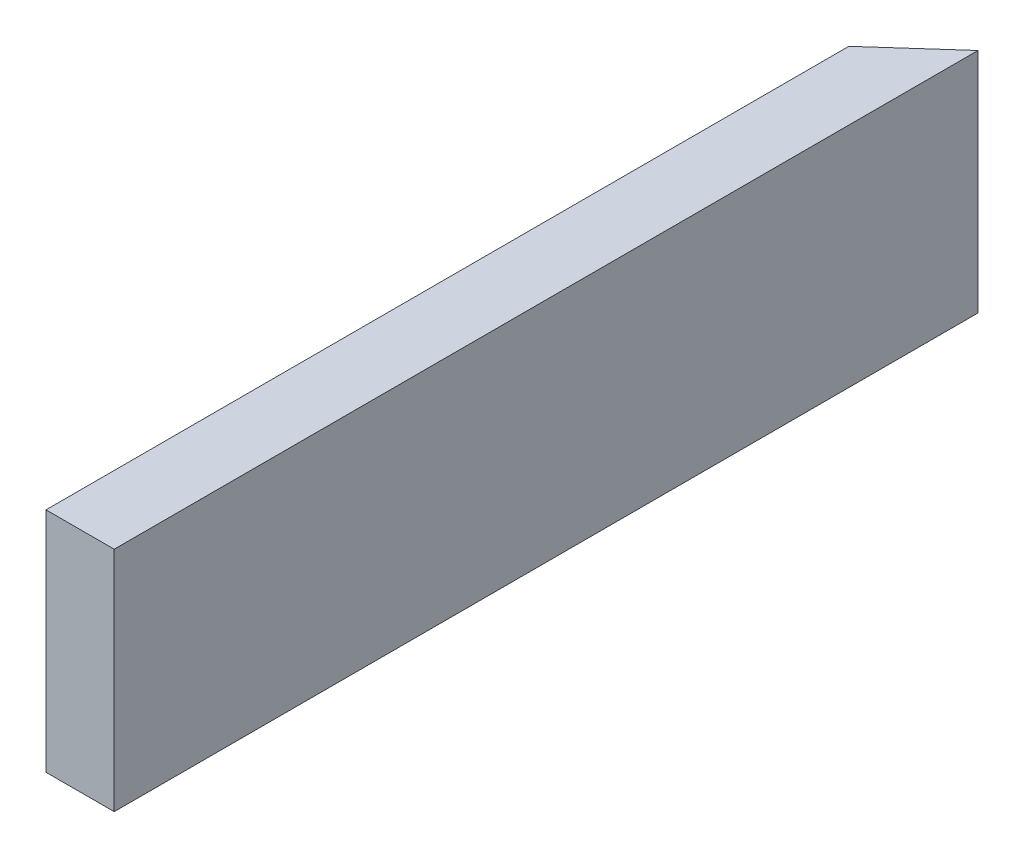
from build123d import *

# Parameters (mm, degrees)
SKETCH1_W           = 3
SKETCH1_H           = 10
BOSS_EXTRUDE1_DEPTH = 38
CUT_EXTRUDE1_DEPTH  = 52


with BuildPart() as part:
    # Sketch1 → Boss-Extrude1 (new body)
    with BuildSketch(Plane.XY):
        with Locations((-2.403225806, 7.838709677)):
            Rectangle(SKETCH1_W, SKETCH1_H)
    extrude(amount=BOSS_EXTRUDE1_DEPTH)

    # Sketch3 → Cut-Extrude1 (cut)
    with BuildSketch(Plane(origin=(0, 12.838709677, 0), x_dir=(1, 0, 0), z_dir=(0, 1, 0))):
        Polygon((-0.903225806, 0), (-3.903225806, -2.682309573), (-3.903225806, 0), align=None)
    extrude(amount=-CUT_EXTRUDE1_DEPTH, mode=Mode.SUBTRACT)


solid = part.part
